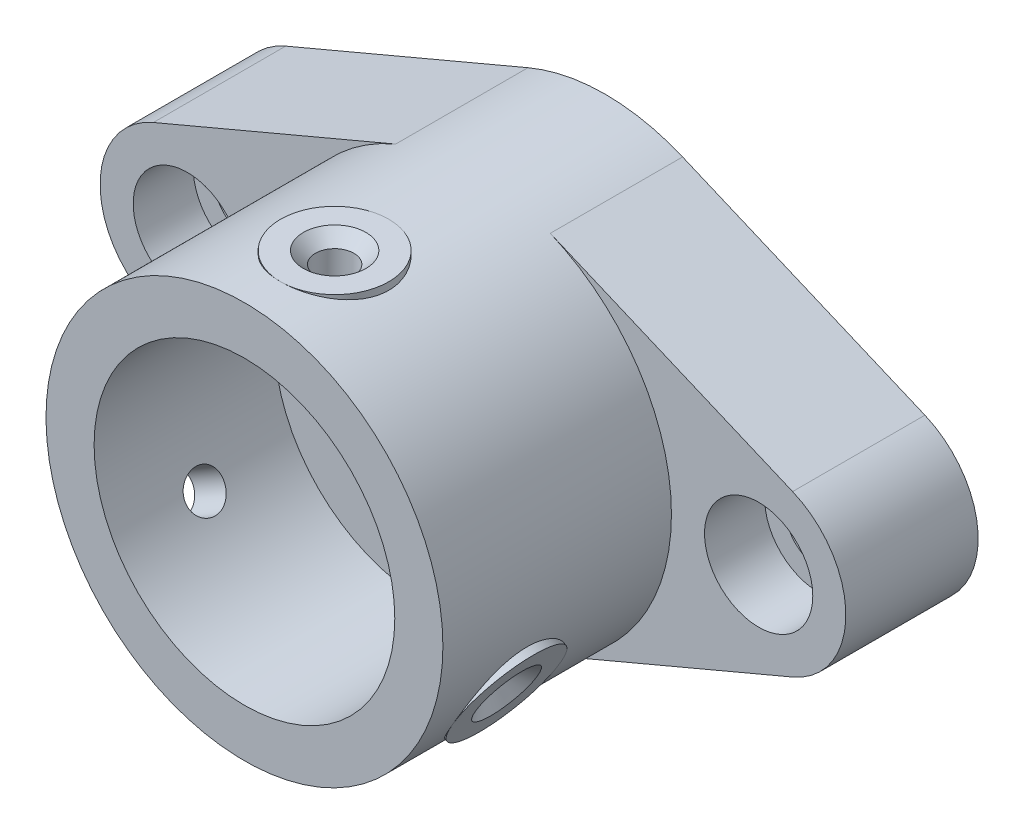
from build123d import *

# Parameters (mm, degrees)
SKETCH1_R                = 16.5
SKETCH1_R_2              = 12.5
BOSS_EXTRUDE1_DEPTH      = 15
BOSS_EXTRUDE2_START      = 15
SKETCH2_R                = 16.5
BOSS_EXTRUDE2_DEPTH      = 15
BOSS_EXTRUDE3_REACH      = 41.828
BOSS_EXTRUDE3_END_RADIUS = 16.5
SKETCH3_R                = 4.5
CUT_EXTRUDE1_REACH       = 41.828
CUT_EXTRUDE1_END_RADIUS  = 12.5
SKETCH4_R                = 1.6
CIRPATTERN1_COUNT        = 3
CHAMFER1_SIZE            = 1
SKETCH5_R                = 2.75
BOSS_EXTRUDE4_DEPTH      = 11
SKETCH6_R                = 4.5
CUT_EXTRUDE2_DEPTH       = 5


with BuildPart() as part:
    # Sketch1 → Boss-Extrude1 (new body)
    with BuildSketch(Plane.XY):
        Circle(SKETCH1_R)
        Circle(SKETCH1_R_2, mode=Mode.SUBTRACT)
    extrude(amount=BOSS_EXTRUDE1_DEPTH)

    # Sketch2 → Boss-Extrude2 (add)
    with BuildSketch(Plane(origin=(0, 0, 0), x_dir=(-1, 0, 0), z_dir=(0, 0, -1)).offset(BOSS_EXTRUDE2_START)):
        Circle(SKETCH2_R)
    extrude(amount=-BOSS_EXTRUDE2_DEPTH)

    # Boss-Extrude3: up to this cylinder (the profile starts outside it)
    boss_extrude3_end = Plane(origin=(0, 0, 7.5), z_dir=(0, 0, -1)) * Cylinder(BOSS_EXTRUDE3_END_RADIUS, 117.656, mode=Mode.PRIVATE)
    # Sketch3 → Boss-Extrude3 (add, up to the surface)
    with BuildSketch(Plane(origin=(0, 16.5, 0), x_dir=(1, 0, 0), z_dir=(0, 1, 0)), mode=Mode.PRIVATE) as boss_extrude3_sk1:
        with Locations((0, -7.5)):
            Circle(SKETCH3_R)
    boss_extrude3_tool1 = extrude(boss_extrude3_sk1.sketch, amount=-BOSS_EXTRUDE3_REACH, mode=Mode.PRIVATE) - boss_extrude3_end
    boss_extrude3 = boss_extrude3_tool1.solids().sort_by_distance((0, 16.5, 7.5))[0] + boss_extrude3_tool1.solids().sort_by_distance((0, 16.5, 7.5))[1]
    add(boss_extrude3)

    # Cut-Extrude1: up to this cylinder (the profile starts outside it)
    cut_extrude1_end = Plane(origin=(0, 0, 7.5), z_dir=(0, 0, -1)) * Cylinder(CUT_EXTRUDE1_END_RADIUS, 109.656, mode=Mode.PRIVATE)
    # Sketch4 → Cut-Extrude1 (cut, up to the surface)
    with BuildSketch(Plane(origin=(0, 16.5, 0), x_dir=(1, 0, 0), z_dir=(0, 1, 0)), mode=Mode.PRIVATE) as cut_extrude1_sk1:
        with Locations((0, -7.5)):
            Circle(SKETCH4_R)
    cut_extrude1_tool1 = extrude(cut_extrude1_sk1.sketch, amount=-CUT_EXTRUDE1_REACH, mode=Mode.PRIVATE) - cut_extrude1_end
    cut_extrude1 = cut_extrude1_tool1.solids().sort_by_distance((0, 16.5, 7.5))[0]
    add(cut_extrude1, mode=Mode.SUBTRACT)

    # CirPattern1: Boss-Extrude3, Cut-Extrude1 ×3 about axis
    cirpattern1_axis = Axis((0, 0, 15), (0, 0, 1))
    add([boss_extrude3.rotate(cirpattern1_axis, i * 360 / CIRPATTERN1_COUNT) for i in range(1, CIRPATTERN1_COUNT)])
    add([cut_extrude1.rotate(cirpattern1_axis, i * 360 / CIRPATTERN1_COUNT) for i in range(1, CIRPATTERN1_COUNT)], mode=Mode.SUBTRACT)

    # Chamfer1
    chamfer1_edges = [part.edges().sort_by_distance(p)[0] for p in [
        (-13.489419162, -9.635640646, 7.5),
        (15.089419162, -6.864359354, 7.5),
        (-1.6, 16.5, 7.5),
    ]]
    chamfer(chamfer1_edges, length=CHAMFER1_SIZE)

    # Sketch5 → Boss-Extrude4 (add)
    with BuildSketch(Plane(origin=(0, 0, -15), x_dir=(-1, 0, 0), z_dir=(0, 0, -1))):
        with BuildLine():
            Line((26.573684211, 6.677522556), (6.426315789, 15.197120299))
            ThreePointArc((6.426315789, 15.197120299), (0, 16.5), (-6.426315789, 15.197120299))
            Line((-6.426315789, 15.197120299), (-26.573684211, 6.677522556))
            ThreePointArc((-26.573684211, 6.677522556), (-31, 0), (-26.573684211, -6.677522556))
            Line((-26.573684211, -6.677522556), (-6.426315789, -15.197120299))
            ThreePointArc((-6.426315789, -15.197120299), (0, -16.5), (6.426315789, -15.197120299))
            Line((6.426315789, -15.197120299), (26.573684211, -6.677522556))
            ThreePointArc((26.573684211, -6.677522556), (31, 0), (26.573684211, 6.677522556))
        make_face()
        with Locations((23.75, 0)):
            Circle(SKETCH5_R, mode=Mode.SUBTRACT)
        with Locations((-23.75, 0)):
            Circle(SKETCH5_R, mode=Mode.SUBTRACT)
    extrude(amount=-BOSS_EXTRUDE4_DEPTH)

    # Sketch6 → Cut-Extrude2 (cut)
    with BuildSketch(Plane.XY.offset(-4)):
        with Locations((-23.75, 0)):
            Circle(SKETCH6_R)
        with Locations((23.75, 0)):
            Circle(SKETCH6_R)
    extrude(amount=-CUT_EXTRUDE2_DEPTH, mode=Mode.SUBTRACT)


solid = part.part
